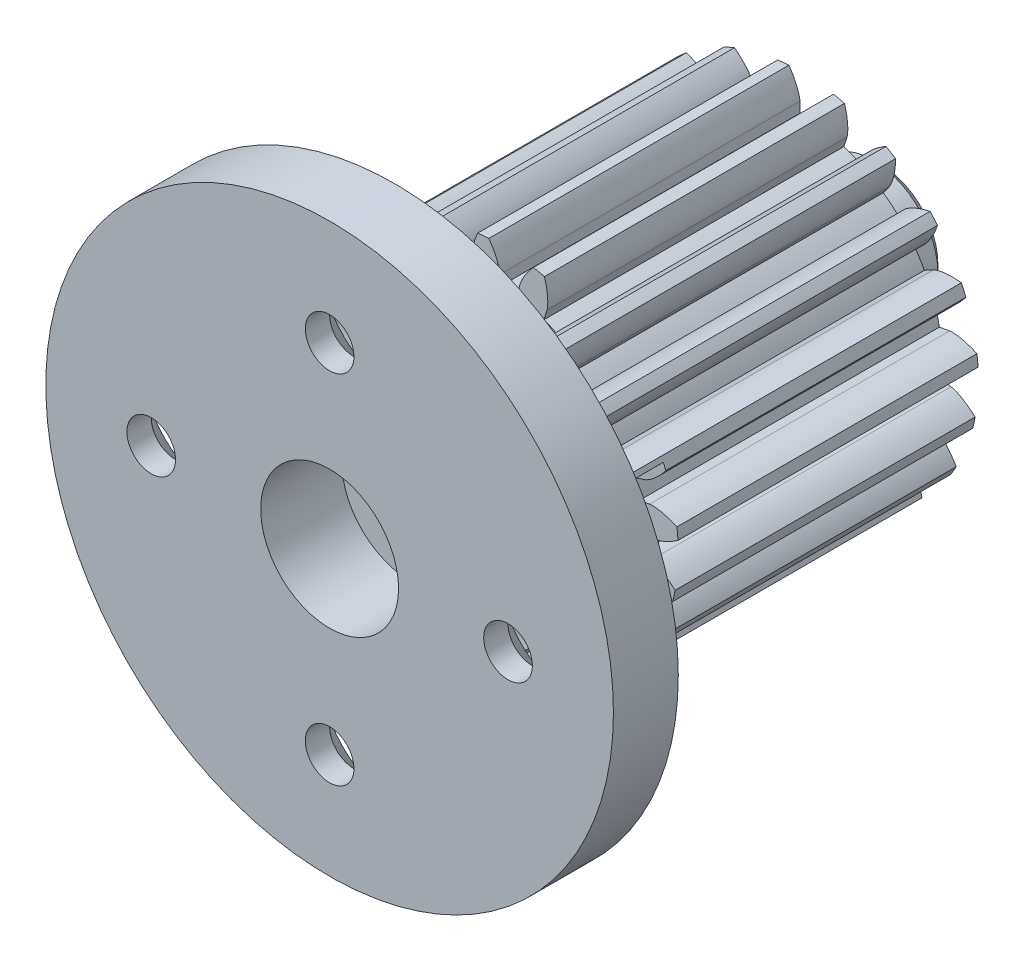
from build123d import *

# Parameters (mm, degrees)
SKETCH1_R           = 11
BOSS_EXTRUDE1_DEPTH = 12.5
CUT_EXTRUDE1_DEPTH  = 20.956202043
CIRPATTERN2_COUNT   = 20
SKETCH3_W           = 17.5
SKETCH3_H           = 4
CHAMFER1_SIZE       = 0.5
CHAMFER2_SIZE       = 0.5
SKETCH4_R           = 2.5
CUT_EXTRUDE2_DEPTH  = 43.05353739
SKETCH5_R           = 4.25
CUT_EXTRUDE3_DEPTH  = 5
SKETCH6_R           = 1.5
CUT_EXTRUDE4_DEPTH  = 39.890873055
CIRPATTERN3_COUNT   = 4
SKETCH8_R           = 4.5
CUT_EXTRUDE9_DEPTH  = 6.5


with BuildPart() as part:
    # Sketch1 → Boss-Extrude1 (new, symmetric)
    with BuildSketch(Plane.XY):
        Circle(SKETCH1_R)
    extrude(amount=BOSS_EXTRUDE1_DEPTH, both=True)

    # Sketch2 → Cut-Extrude1 (cut, symmetric)
    with BuildSketch(Plane.XY):
        with BuildLine():
            add(Edge.make_bspline(
                [(9.396926208, 0), (9.400138583, 4.6216e-05), (9.409146235, 0.000318961), (9.426163522, 0.001399731), (9.453894805, 0.003965251), (9.489159988, 0.008411766), (9.534633285, 0.015508917), (9.588036436, 0.025602449), (9.646517918, 0.038506069), (9.709884453, 0.054493183), (9.772845578, 0.072160933), (9.835388227, 0.091379097), (9.897435615, 0.111957553), (9.972266099, 0.138572183), (10.06152026, 0.172827787), (10.16508062, 0.216257712), (10.281576815, 0.269499377), (10.399183597, 0.327986428), (10.513953634, 0.388998713), (10.628720419, 0.454581557), (10.738911244, 0.520825098), (10.843340189, 0.588020347), (10.913824313, 0.634861114), (10.959992051, 0.666737994), (10.978961804, 0.679998317)],
                knots=[0, 0, 0, 0, 0, 0.005376749, 0.015083688, 0.02853182, 0.04661014, 0.064854849, 0.092110525, 0.119476176, 0.146842496, 0.174208854, 0.201574956, 0.228941013, 0.256307345, 0.307035032, 0.361767352, 0.416499661, 0.471231937, 0.525964282, 0.580696616, 0.635428982, 0.690161387, 0.728074997, 0.728074997, 0.728074997, 0.728074997, 0.728074997], degree=4))
            Line((9.396926208, 0), (8.75, 0))
            ThreePointArc((8.75, 0), (8.732289554, -0.556434313), (8.67922991, -1.110616123))
            Line((8.67922991, -1.110616123), (9.320923772, -1.192728886))
            add(Edge.make_bspline(
                [(9.320923772, -1.192728886), (9.3241043, -1.193182467), (9.333004478, -1.194596325), (9.34974695, -1.197828317), (9.376928306, -1.20389295), (9.411343879, -1.212779626), (9.455548564, -1.225591189), (9.507238643, -1.242381416), (9.5636093, -1.262603583), (9.624434121, -1.286504353), (9.684643491, -1.312020707), (9.74424098, -1.339021821), (9.803174555, -1.367309361), (9.874021679, -1.403206782), (9.958205971, -1.448514139), (10.05541628, -1.504737466), (10.164212418, -1.57233509), (10.273444377, -1.645276638), (10.379542013, -1.720362935), (10.485056292, -1.799982413), (10.585947762, -1.879676427), (10.681003156, -1.959583111), (10.74497182, -2.014991407), (10.786720097, -2.052470425), (10.803853323, -2.068031283)],
                knots=[0, 0, 0, 0, 0, 0.005376749, 0.015083688, 0.02853182, 0.04661014, 0.064854849, 0.092110525, 0.119476176, 0.146842496, 0.174208854, 0.201574956, 0.228941013, 0.256307345, 0.307035032, 0.361767352, 0.416499661, 0.471231937, 0.525964282, 0.580696616, 0.635428982, 0.690161387, 0.728074997, 0.728074997, 0.728074997, 0.728074997, 0.728074997], degree=4))
            ThreePointArc((10.803853323, -2.068031283), (10.950853541, -1.038656212), (11, 0))
            ThreePointArc((11, 0), (10.994739193, 0.340161843), (10.978961804, 0.679998317))
        make_face()
    cut_extrude1 = extrude(amount=CUT_EXTRUDE1_DEPTH, both=True, mode=Mode.SUBTRACT)

    # CirPattern2: Cut-Extrude1 ×20 about axis
    cirpattern2_axis = Axis((0, 0, -12.5), (0, 0, 1))
    for i in range(1, CIRPATTERN2_COUNT):
        add(cut_extrude1.rotate(cirpattern2_axis, i * 360 / CIRPATTERN2_COUNT), mode=Mode.SUBTRACT)

    # Sketch3 → Revolve1 (revolve)
    with BuildSketch(Plane(origin=(0, 0, 0), x_dir=(1, 0, 0), z_dir=(0, 1, 0))):
        Polygon((0, 12.5), (0, 17.5), (-4, 17.5), (-4, 14), (-4.5, 14), (-4.5, 12.5), align=None)
        with Locations((-8.75, -14.5)):
            Rectangle(SKETCH3_W, SKETCH3_H)
    revolve(axis=Axis((0, 0, -12.5), (0, 0, -1)))

    # Chamfer1
    chamfer1_edges = [part.edges().sort_by_distance(p)[0] for p in [
        (4.5, 0, -12.5),
    ]]
    chamfer(chamfer1_edges, length=CHAMFER1_SIZE)

    # Chamfer2
    chamfer2_edges = [part.edges().sort_by_distance(p)[0] for p in [
        (4, 0, -17.5),
    ]]
    chamfer(chamfer2_edges, length=CHAMFER2_SIZE)

    # Sketch4 → Cut-Extrude2 (cut, through all)
    with BuildSketch(Plane.XY.offset(16.5)):
        Circle(SKETCH4_R)
    extrude(amount=-CUT_EXTRUDE2_DEPTH, mode=Mode.SUBTRACT)

    # Sketch5 → Cut-Extrude3 (cut)
    with BuildSketch(Plane.XY.offset(16.5)):
        Circle(SKETCH5_R)
    extrude(amount=-CUT_EXTRUDE3_DEPTH, mode=Mode.SUBTRACT)

    # Sketch6 → Cut-Extrude4 (cut, through all)
    with BuildSketch(Plane(origin=(0, 0, 12.5), x_dir=(-1, 0, 0), z_dir=(0, 0, -1))):
        with Locations((0, 11)):
            Circle(SKETCH6_R)
        with Locations((11, 0)):
            Circle(SKETCH6_R)
        with Locations((0, -11)):
            Circle(SKETCH6_R)
        with Locations((-11, 0)):
            Circle(SKETCH6_R)
    extrude(amount=-CUT_EXTRUDE4_DEPTH, mode=Mode.SUBTRACT)

    # Sketch7 → Cut-Revolve1 (revolve, cut)
    with BuildSketch(Plane(origin=(0, 0, 0), x_dir=(1, 0, 0), z_dir=(0, 1, 0))):
        Polygon((15.5, -12.5), (11, -12.5), (11, -15), (12.5, -15), align=None)
    cut_revolve1 = revolve(axis=Axis((11, 0, 12.5), (0, 0, 1)), mode=Mode.SUBTRACT)

    # CirPattern3: Cut-Revolve1 ×4 about axis
    cirpattern3_axis = Axis((0, 0, -17.5), (0, 0, 1))
    for i in range(1, CIRPATTERN3_COUNT):
        add(cut_revolve1.rotate(cirpattern3_axis, i * 360 / CIRPATTERN3_COUNT), mode=Mode.SUBTRACT)

    # Sketch8 → Cut-Extrude9 (cut)
    with BuildSketch(Plane(origin=(0, 0, 12.5), x_dir=(-1, 0, 0), z_dir=(0, 0, -1))):
        with Locations((0, 11)):
            Circle(SKETCH8_R)
        with Locations((11, 0)):
            Circle(SKETCH8_R)
        with Locations((0, -11)):
            Circle(SKETCH8_R)
        with Locations((-11, 0)):
            Circle(SKETCH8_R)
    extrude(amount=CUT_EXTRUDE9_DEPTH, mode=Mode.SUBTRACT)


solid = part.part
